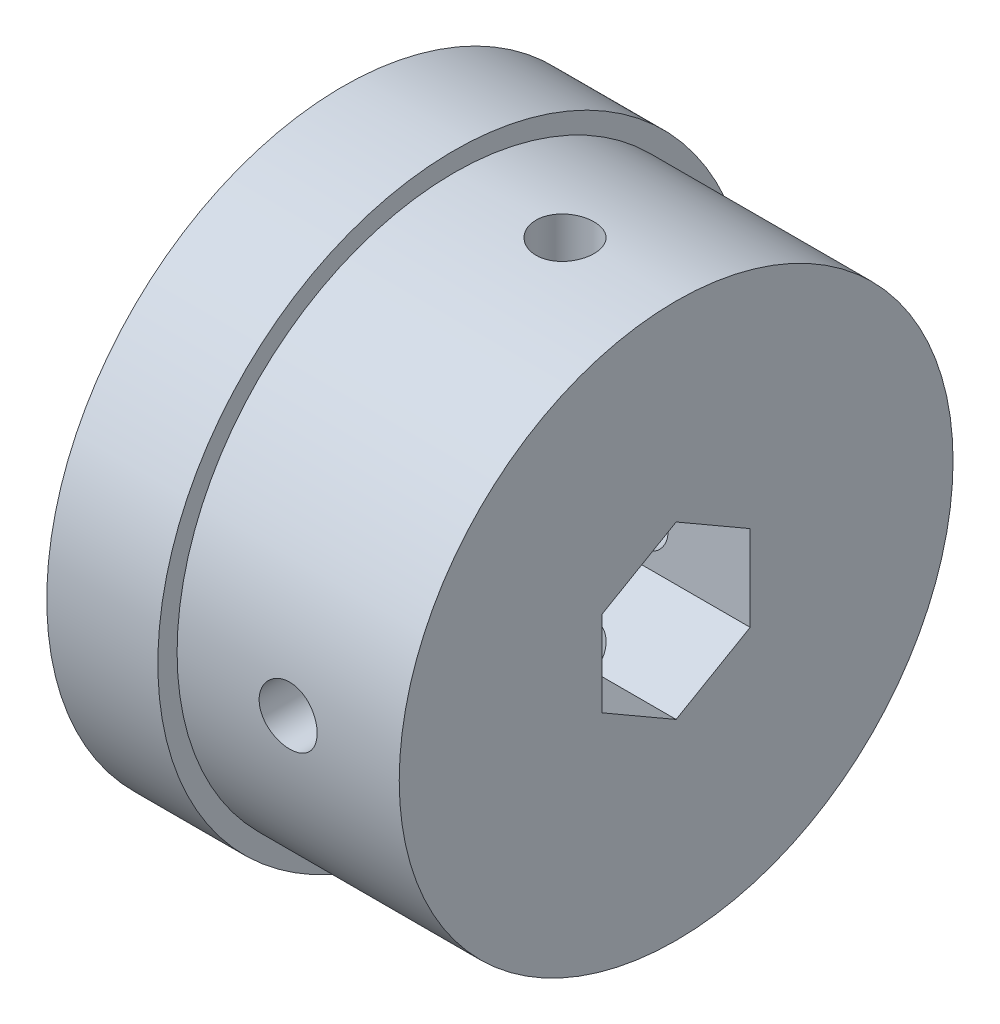
from build123d import *

# Parameters (mm, degrees)
SKETCH1_R               = 23.749
BOSS_EXTRUDE1_DEPTH     = 19.05
SKETCH2_R               = 25.4
BOSS_EXTRUDE2_DEPTH     = 9.525
CUT_EXTRUDE1_DEPTH      = 46.900442536
CUT_EXTRUDE3_DEPTH      = 41.659838908
CUT_EXTRUDE3_DEPTH_BACK = 41.659838908
SKETCH6_R               = 2.4892
CUT_EXTRUDE5_DEPTH      = 41.659838955
CUT_EXTRUDE5_DEPTH_BACK = 41.659838955
SKETCH12_R              = 2.4892


with BuildPart() as part:
    # Sketch1 → Boss-Extrude1 (new body)
    with BuildSketch(Plane(origin=(0, 0, 0), x_dir=(0, 0, -1), z_dir=(1, 0, 0))):
        Circle(SKETCH1_R)
    extrude(amount=BOSS_EXTRUDE1_DEPTH)

    # Sketch2 → Boss-Extrude2 (add)
    with BuildSketch(Plane.ZY):
        Circle(SKETCH2_R)
    extrude(amount=BOSS_EXTRUDE2_DEPTH)

    # Sketch4 → Cut-Extrude1 (cut, through all)
    with BuildSketch(Plane.ZY.offset(9.525)):
        Polygon((0, 7.332348419), (-6.35, 3.666174209), (-6.35, -3.666174209), (0, -7.332348419), (6.35, -3.666174209), (6.35, 3.666174209), align=None)
    extrude(amount=-CUT_EXTRUDE1_DEPTH, mode=Mode.SUBTRACT)

    # Sketch6 → Cut-Extrude3 (cut, two sides: drawn at the far end of the back side and taken through both)
    with BuildSketch(Plane.XY.offset(-CUT_EXTRUDE3_DEPTH_BACK)):
        with Locations((9.525, 0)):
            Circle(SKETCH6_R)
    extrude(amount=CUT_EXTRUDE3_DEPTH + CUT_EXTRUDE3_DEPTH_BACK, mode=Mode.SUBTRACT)

    # Sketch12 → Cut-Extrude5 (cut, two sides: drawn at the far end of the back side and taken through both)
    with BuildSketch(Plane(origin=(0, 0, 0), x_dir=(1, 0, 0), z_dir=(0, 1, 0)).offset(-CUT_EXTRUDE5_DEPTH_BACK)):
        with Locations((9.525, 0)):
            Circle(SKETCH12_R)
    extrude(amount=CUT_EXTRUDE5_DEPTH + CUT_EXTRUDE5_DEPTH_BACK, mode=Mode.SUBTRACT)


solid = part.part
